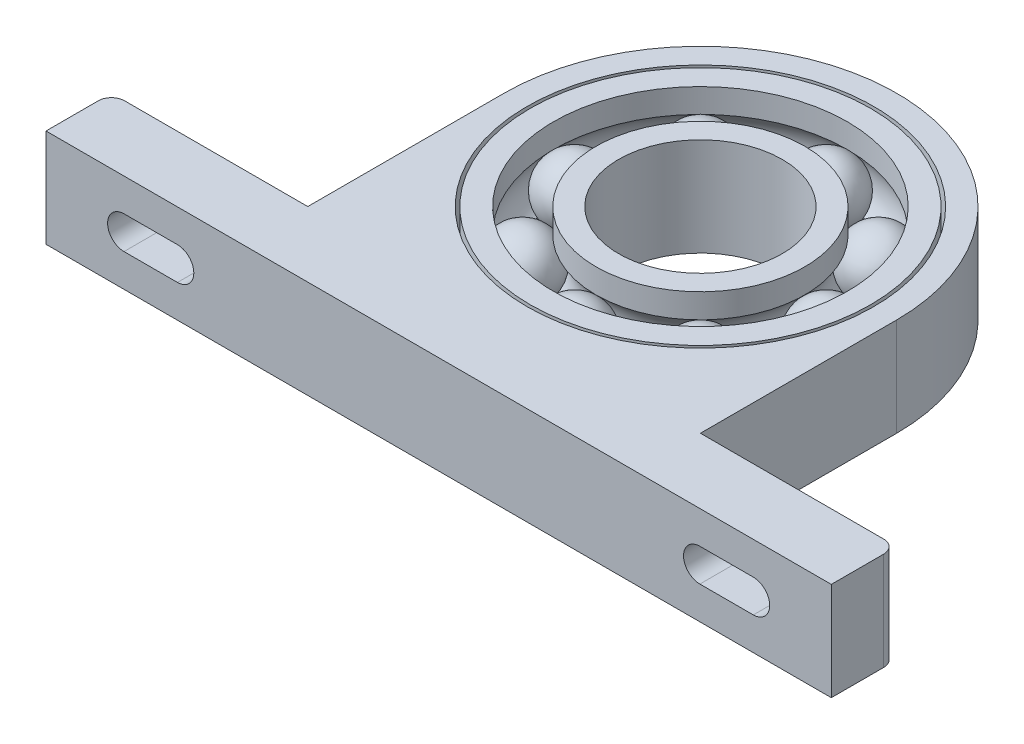
from build123d import *

# Parameters (mm, degrees)
CIRPATTERN1_COUNT   = 8
SKETCH5_R           = 26.5
BOSS_EXTRUDE2_DEPTH = 7.5
FILLET1_R           = 2
CUT_EXTRUDE1_DEPTH  = 15


with BuildPart() as part:
    # Sketch1 → Revolve1 (revolve)
    with BuildSketch(Plane.XY):
        with BuildLine():
            Line((-19.22889081502279, 4.999999999999999), (-19.22889081502279, -5.000000000000001))
            ThreePointArc((-19.22889081502279, -5), (-17.483549549096534, -4.685486513208093), (-15.957781630045586, -3.7815135461819747))
            ThreePointArc((-15.957781630045586, -3.781513546181975), (-14.22889081502279, -3.3e-16), (-15.957781630045588, 3.781513546181974))
            ThreePointArc((-15.957781630045586, 3.7815135461819738), (-17.483549549096537, 4.685486513208094), (-19.22889081502279, 5))
        make_face()
    revolve(axis=Axis((-19.22889081502279, -5.000000000000001, 0), (0, 1, 0)))

    # Sketch1<4> → Revolve3 (revolve)
    with BuildSketch(Plane.XY):
        with BuildLine():
            ThreePointArc((-15.957781630045588, 3.781513546181974), (-14.22889081502279, -3.3e-16), (-15.957781630045586, -3.781513546181975))
            Line((-15.957781630045586, -3.781513546181975), (-15.957781630045586, -7.499999999999998))
            Line((-15.957781630045586, -7.499999999999998), (-12.499999999999998, -7.499999999999991))
            Line((-12.499999999999998, -7.499999999999992), (-12.5, 7.500000000000008))
            Line((-12.5, 7.500000000000008), (-15.957781630045586, 7.5))
            Line((-15.957781630045586, 7.5), (-15.957781630045586, 3.7815135461819738))
        make_face()
        with BuildLine():
            Line((-22.457781630045584, 7.5), (-25.999999999999996, 7.5000000000000036))
            Line((-25.999999999999996, 7.5000000000000036), (-25.999999999999993, -7.4999999999999964))
            Line((-25.999999999999993, -7.4999999999999964), (-22.457781630045588, -7.5))
            Line((-22.457781630045588, -7.5), (-22.457781630045588, -3.8176254536899545))
            ThreePointArc((-22.457781630045588, -3.817625453689954), (-24.228890815022794, 1.22e-15), (-22.457781630045588, 3.8176254536899554))
            Line((-22.457781630045588, 3.817625453689955), (-22.457781630045584, 7.5))
        make_face()
    revolve(axis=Axis((0, -10.609146633934474, 0), (0, 1, 0)))

    # CirPattern1: part ×8 about axis
    cirpattern1_axis = Axis((0, 0, 0), (0, -1, 0))


with BuildPart() as part_1:
    add(part.part)
    for i in range(1, CIRPATTERN1_COUNT):
        add(part.part.rotate(cirpattern1_axis, i * 360 / CIRPATTERN1_COUNT))


with BuildPart() as body_2:
    # Sketch5 → Boss-Extrude2 (new, symmetric)
    with BuildSketch(Plane(origin=(0, 0, 0), x_dir=(1, 0, 0), z_dir=(0, 1, 0))):
        with BuildLine():
            Line((30, 0), (30, -30))
            Line((30, -30), (60, -30))
            Line((60, -30), (60, -40))
            Line((60, -40), (-59.999999999999986, -40))
            Line((-59.999999999999986, -40), (-59.999999999999986, -30))
            Line((-59.999999999999986, -30), (-30, -30))
            Line((-30, -30), (-30, 0))
            ThreePointArc((-30, 0), (1.84e-15, 30), (30, 0))
        make_face()
        Circle(SKETCH5_R, mode=Mode.SUBTRACT)
    extrude(amount=BOSS_EXTRUDE2_DEPTH, both=True)

    # Fillet1
    fillet1_edges = [body_2.edges().sort_by_distance(p)[0] for p in [
        (60, 0, 30),
        (-59.999999999999986, 0, 30),
    ]]
    fillet(fillet1_edges, radius=FILLET1_R)

    # Sketch6 → Cut-Extrude1 (cut)
    with BuildSketch(Plane(origin=(0, 0, 30), x_dir=(-1, 0, 0), z_dir=(0, 0, -1))):
        with BuildLine():
            Line((48.08422803782548, 2.5000000000000004), (39.915771962174496, 2.5000000000000004))
            ThreePointArc((39.915771962174496, 2.5), (37.415771962174496, 4e-17), (39.915771962174496, -2.5))
            Line((39.915771962174496, -2.5000000000000004), (48.08422803782548, -2.4999999999999996))
            ThreePointArc((48.08422803782548, -2.4999999999999996), (50.58422803782548, 2.9e-16), (48.08422803782548, 2.5000000000000004))
        make_face()
        with BuildLine():
            ThreePointArc((-39.915771962174496, -2.5), (-37.415771962174496, 1.5e-16), (-39.915771962174496, 2.5))
            Line((-39.915771962174496, 2.5000000000000004), (-48.08422803782548, 2.5000000000000004))
            ThreePointArc((-48.08422803782548, 2.5000000000000004), (-50.58422803782548, 2.9e-16), (-48.08422803782548, -2.4999999999999996))
            Line((-48.08422803782548, -2.4999999999999996), (-39.915771962174496, -2.5000000000000004))
        make_face()
    extrude(amount=-CUT_EXTRUDE1_DEPTH, mode=Mode.SUBTRACT)


solid = Compound([part_1.part, body_2.part])
